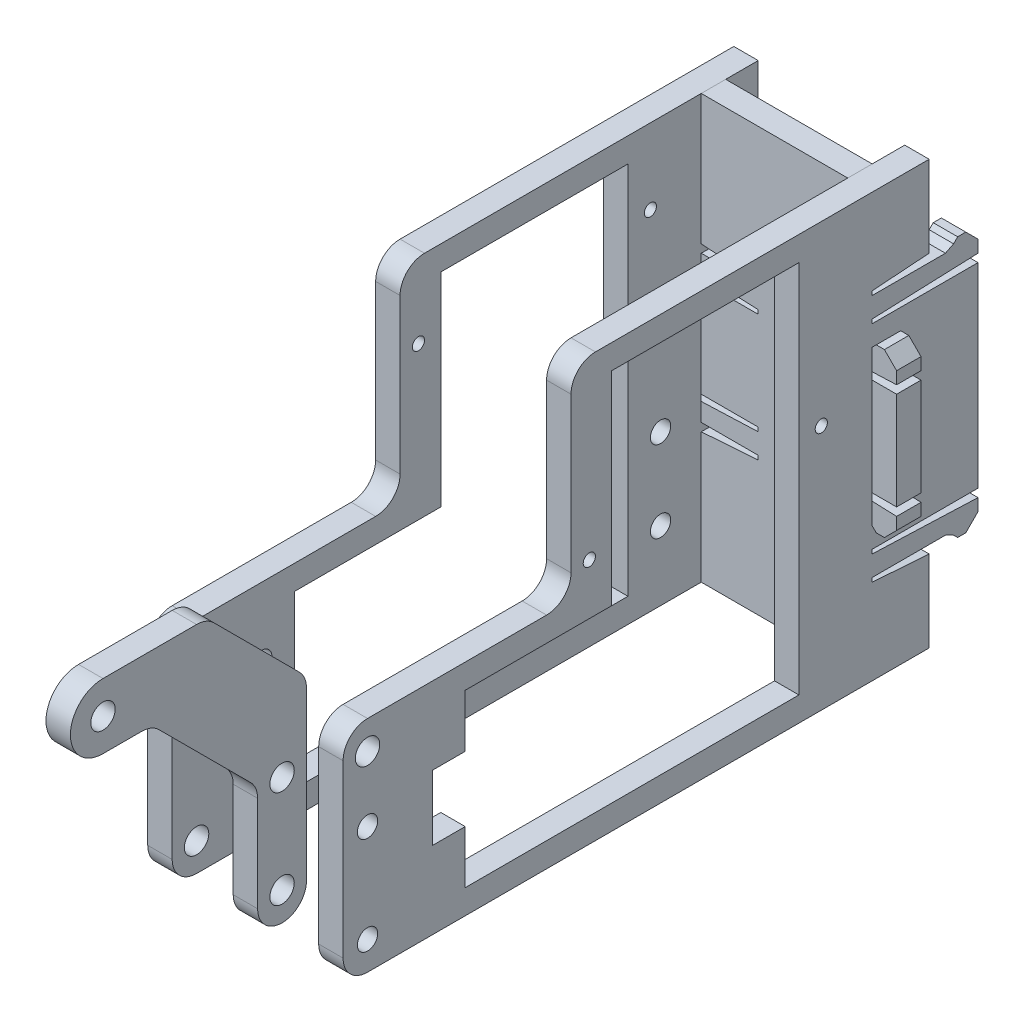
from build123d import *

# Parameters (mm, degrees)
SKETCH1_R           = 1.25
SKETCH1_R_2         = 0.75
SKETCH1_R_3         = 1.5
SKETCH1_W           = 3
SKETCH1_H           = 18
BOSS_EXTRUDE1_DEPTH = 3
SKETCH2_R           = 1.5
SKETCH2_R_2         = 0.75
SKETCH2_R_3         = 1.25
SKETCH2_W           = 3
SKETCH2_H           = 18
BOSS_EXTRUDE2_DEPTH = 3
BOSS_EXTRUDE3_DEPTH = 3
SKETCH4_R           = 1.5
BOSS_EXTRUDE4_DEPTH = 1.5
FILLET1_R           = 3
FILLET2_R           = 3
FILLET3_R           = 3


with BuildPart() as part:
    # Sketch1 → Boss-Extrude1 (new body)
    with BuildSketch(Plane(origin=(9, 0, 0), x_dir=(0, 0, -1), z_dir=(1, 0, 0))):
        Polygon((6, 38), (6, 14), (-7, 14), (-7, 13.5), (6, 13), (6, 11.5), (4.5, 10), (3.5, 10), (3, 10.5), (2, 11), (-7, 11), (-7, 10.5), (0, 10), (0, 0), (-72, 0), (-72, 27), (-44, 27), (-44, 52), (0, 52), (0, 42), (-7, 41.5), (-7, 41), (2, 41), (3, 41.5), (3.5, 42), (4.5, 42), (6, 40.5), (6, 39), (-7, 38.5), (-7, 38), align=None)
        with Locations((-69, 15.5)):
            Circle(SKETCH1_R, mode=Mode.SUBTRACT)
        with Locations((-41.75, 30.25)):
            Circle(SKETCH1_R_2, mode=Mode.SUBTRACT)
        with Locations((-13.25, 30.25)):
            Circle(SKETCH1_R_2, mode=Mode.SUBTRACT)
        with Locations((-69, 23.5)):
            Circle(SKETCH1_R_3, mode=Mode.SUBTRACT)
        with Locations((-69, 3.5)):
            Circle(SKETCH1_R, mode=Mode.SUBTRACT)
        Polygon((-57, 17.5), (-57, 24), (-39, 24), (-39, 49), (-16, 49), (-16, 3), (-57, 3), (-57, 9.5), (-61, 9.5), (-61, 17.5), align=None, mode=Mode.SUBTRACT)
        with Locations((-5.5, 26)):
            Rectangle(SKETCH1_W, SKETCH1_H, mode=Mode.SUBTRACT)
    extrude(amount=BOSS_EXTRUDE1_DEPTH)

    # Fillet2
    fillet2_edges = [part.edges().sort_by_distance(p)[0] for p in [
        (10.5, 0, 72),
        (10.5, 27, 72),
        (10.5, 27, 44),
        (10.5, 52, 44),
    ]]
    fillet(fillet2_edges, radius=FILLET2_R)


with BuildPart() as body_2:
    # Sketch2 → Boss-Extrude2 (new body)
    with BuildSketch(Plane(origin=(-9, 0, 0), x_dir=(0, 0, -1), z_dir=(1, 0, 0))):
        Polygon((0, 0), (-72, 0), (-72, 27), (-44, 27), (-44, 52), (0, 52), (0, 42), (-7, 41.5), (-7, 41), (2, 41), (3, 41.5), (3.5, 42), (4.5, 42), (6, 40.5), (6, 39), (-7, 38.5), (-7, 38), (6, 38), (6, 14), (-7, 14), (-7, 13.5), (6, 13), (6, 11.5), (4.5, 10), (3.5, 10), (3, 10.5), (2, 11), (-7, 11), (-7, 10.5), (0, 10), align=None)
        with Locations((-69, 23.5)):
            Circle(SKETCH2_R, mode=Mode.SUBTRACT)
        with Locations((-69, 3.5)):
            Circle(SKETCH2_R, mode=Mode.SUBTRACT)
        with Locations((-13.25, 42.75)):
            Circle(SKETCH2_R_2, mode=Mode.SUBTRACT)
        with Locations((-41.75, 42.75)):
            Circle(SKETCH2_R_2, mode=Mode.SUBTRACT)
        with Locations((-12, 18.5)):
            Circle(SKETCH2_R_3, mode=Mode.SUBTRACT)
        with Locations((-12, 8.5)):
            Circle(SKETCH2_R_3, mode=Mode.SUBTRACT)
        with Locations((-61, 18.5)):
            Circle(SKETCH2_R_3, mode=Mode.SUBTRACT)
        with Locations((-61, 8.5)):
            Circle(SKETCH2_R_3, mode=Mode.SUBTRACT)
        with Locations((-69, 15.5)):
            Circle(SKETCH2_R, mode=Mode.SUBTRACT)
        with Locations((-5.5, 26)):
            Rectangle(SKETCH2_W, SKETCH2_H, mode=Mode.SUBTRACT)
        Polygon((-16, 49), (-16, 3), (-57, 3), (-57, 24), (-39, 24), (-39, 49), align=None, mode=Mode.SUBTRACT)
    extrude(amount=-BOSS_EXTRUDE2_DEPTH)

    # Fillet3
    fillet3_edges = [body_2.edges().sort_by_distance(p)[0] for p in [
        (-10.5, 0, 72),
        (-10.5, 27, 72),
        (-10.5, 27, 44),
        (-10.5, 52, 44),
    ]]
    fillet(fillet3_edges, radius=FILLET3_R)


with BuildPart() as body_3:
    # Sketch3 → Boss-Extrude3 (new body)
    with BuildSketch(Plane(origin=(0, 0, 7), x_dir=(-1, 0, 0), z_dir=(0, 0, -1))):
        Polygon((15, 20), (15, 32), (2, 32), (2, 32.5), (15, 33), (15, 34.5), (13.5, 36), (12.5, 36), (12, 35.5), (11, 35), (2, 35), (2, 35.5), (9, 36), (9, 52), (-9, 52), (-9, 36), (-2, 35.5), (-2, 35), (-11, 35), (-12, 35.5), (-12.5, 36), (-13.5, 36), (-15, 34.5), (-15, 33), (-2, 32.5), (-2, 32), (-15, 32), (-15, 20), (-2, 20), (-2, 19.5), (-15, 19), (-15, 17.5), (-13.5, 16), (-12.5, 16), (-12, 16.5), (-11, 17), (-2, 17), (-2, 16.5), (-9, 16), (-9, 0), (9, 0), (9, 16), (2, 16.5), (2, 17), (11, 17), (12, 16.5), (12.5, 16), (13.5, 16), (15, 17.5), (15, 19), (2, 19.5), (2, 20), align=None)
    extrude(amount=BOSS_EXTRUDE3_DEPTH)


with BuildPart() as body_4:
    # Sketch4 → Boss-Extrude4 (new, symmetric)
    with BuildSketch(Plane(origin=(0, 0, 0), x_dir=(0, 0, -1), z_dir=(1, 0, 0))):
        with BuildLine():
            Line((-91, 29), (-85, 29))
            Line((-85, 29), (-72, 16))
            Line((-72, 16), (-72, 0))
            Line((-72, 0), (-66, 0))
            Line((-66, 0), (-66, 24.742640687))
            Line((-66, 24.742640687), (-78.257359313, 37))
            Line((-78.257359313, 37), (-91, 37))
            ThreePointArc((-91, 37), (-95, 33), (-91, 29))
        make_face()
        with Locations((-69, 3.5)):
            Circle(SKETCH4_R, mode=Mode.SUBTRACT)
        with Locations((-91, 33)):
            Circle(SKETCH4_R, mode=Mode.SUBTRACT)
        with Locations((-69, 15.5)):
            Circle(SKETCH4_R, mode=Mode.SUBTRACT)
    extrude(amount=BOSS_EXTRUDE4_DEPTH, both=True)

    # Fillet1
    fillet1_edges = [body_4.edges().sort_by_distance(p)[0] for p in [
        (0, 0, 72),
        (0, 0, 66),
        (0, 24.742640687, 66),
        (0, 37, 78.257359313),
        (0, 16, 72),
        (0, 29, 85),
    ]]
    fillet(fillet1_edges, radius=FILLET1_R - 0.0001)  # a hair under: the kernel refuses the full size


solid = Compound([part.part, body_2.part, body_3.part, body_4.part])
